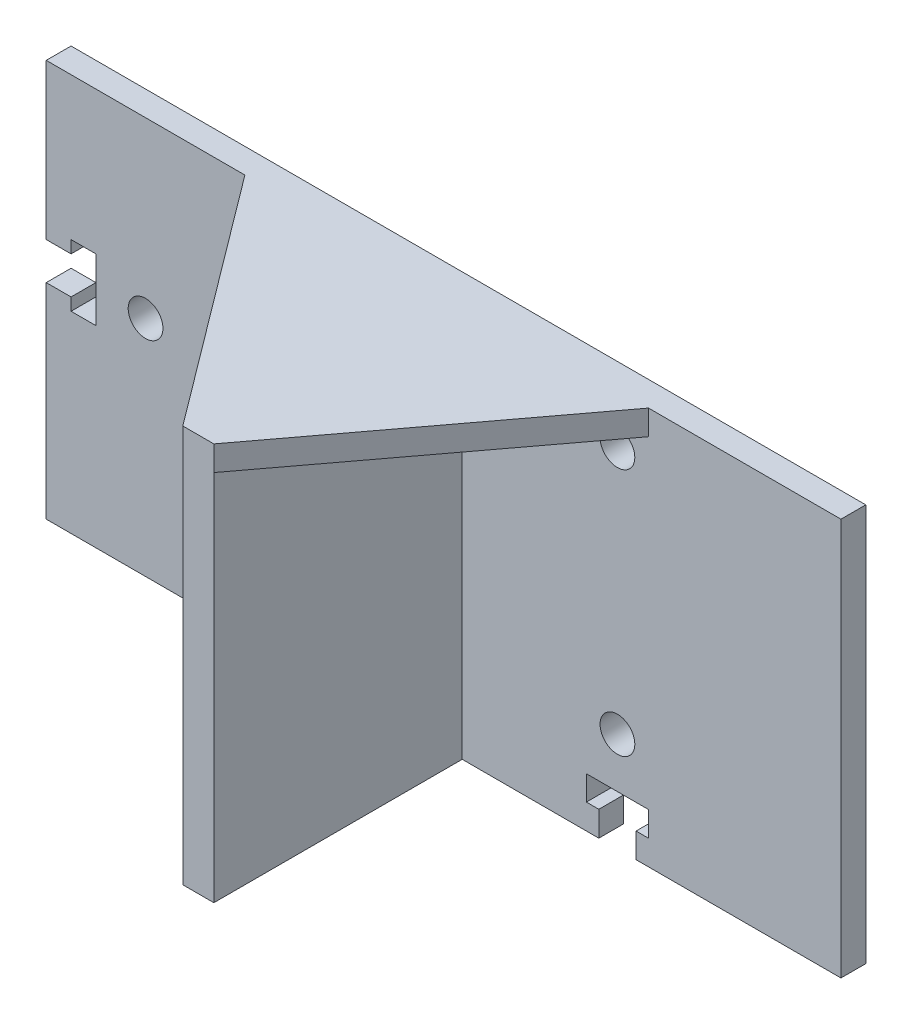
from build123d import *
from OCP.BRepFilletAPI import BRepFilletAPI_MakeChamfer

# Parameters (mm, degrees)
BOSS_EXTRU_1_DEPTH      = 2
BOSS_EXTRU_2_DEPTH      = 20
ESQUISSE2_R             = 1.4
ENL_V_MAT_EXTRU_1_DEPTH = 75.296702484
CHANFREIN1_SIZE         = 15
CHANFREIN1_SIZE_2       = 20


with BuildPart() as part:
    # Esquisse1 → Boss.-Extru.1 (new body)
    with BuildSketch(Plane.XY):
        Polygon((0, 0), (43.5, 0), (44.5, 0), (44.5, 2.018181818), (43.5, 2.018181818), (43.5, 4), (48.5, 4), (48.5, 2), (47.5, 2), (47.5, 0), (48.5, 0), (64, 0), (64, 32), (0, 32), (0, 19.5), (2, 19.5), (2, 20.5), (4, 20.5), (4, 15.5), (2, 15.5), (2, 16.5), (0, 16.5), (0, 13.5), align=None)
    extrude(amount=BOSS_EXTRU_1_DEPTH)

    # Esquisse3 → Boss.-Extru.2 (add)
    with BuildSketch(Plane.XY.offset(2)):
        Polygon((26.917717359, 32), (29.417717359, 32), (48.5, 32), (48.5, 30), (33.5, 30), (33.5, 0), (31, 0), (31, 30), (16, 30), (16, 32), align=None)
    extrude(amount=BOSS_EXTRU_2_DEPTH)

    # Esquisse2 → Enlèv. mat.-Extru.1 (cut, through all)
    with BuildSketch(Plane.XY.offset(2)):
        with Locations((8, 18)):
            Circle(ESQUISSE2_R)
        with Locations((28, 18)):
            Circle(ESQUISSE2_R)
        with Locations((46, 28)):
            Circle(ESQUISSE2_R)
        with Locations((46, 8)):
            Circle(ESQUISSE2_R)
    extrude(amount=-ENL_V_MAT_EXTRU_1_DEPTH, mode=Mode.SUBTRACT)

    # Chanfrein1
    chanfrein1_edges_1 = [part.edges().sort_by_distance(p)[0] for p in [
        (48.5, 31, 22),
    ]]
    chanfrein1_side_1 = [part.faces().sort_by_distance(p)[0] for p in [
        (48.2, 31, 22),
    ]]
    chanfrein1_edges_2 = [part.edges().sort_by_distance(p)[0] for p in [
        (16, 31, 22),
    ]]
    chanfrein1_side_2 = [part.faces().sort_by_distance(p)[0] for p in [
        (16.3, 31, 22),
    ]]
    chanfrein1 = BRepFilletAPI_MakeChamfer(part.part.solid().wrapped)
    for e in chanfrein1_edges_1:
        chanfrein1.Add(CHANFREIN1_SIZE - 0.0001, CHANFREIN1_SIZE_2 - 0.0001, e.wrapped, chanfrein1_side_1[0].wrapped)
    for e in chanfrein1_edges_2:
        chanfrein1.Add(CHANFREIN1_SIZE - 0.0001, CHANFREIN1_SIZE_2 - 0.0001, e.wrapped, chanfrein1_side_2[0].wrapped)
    add(Compound.cast(chanfrein1.Shape()), mode=Mode.REPLACE)  # a hair under: the kernel refuses the full size


solid = part.part
